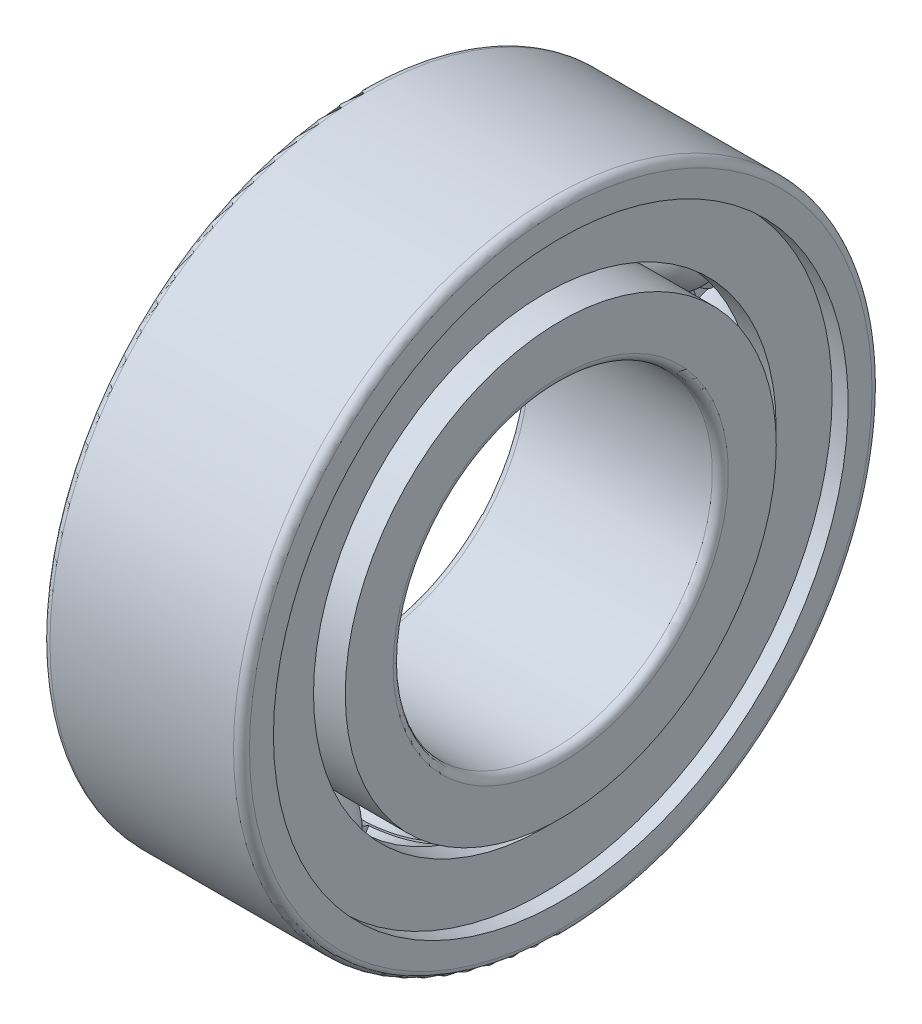
from build123d import *

# Parameters (mm, degrees)
SKETCH_2_W               = 0.528
SKETCH_2_H               = 0.66
PATTERN_CIRCULAR_1_COUNT = 13
SKETCH_4_W               = 2.64
SKETCH_4_H               = 1.32
SKETCH_5_W               = 2.64
SKETCH_5_H               = 1.32
PATTERN_CIRCULAR_2_COUNT = 13
SKETCH_10_W              = 0.535202389
SKETCH_10_H              = 1.454
SKETCH_11_R              = 8
CUT_EXTRUDE_1_DEPTH      = 10


with BuildPart() as part:
    # 草图2 → Revolve 753 (revolve)
    with BuildSketch(Plane.XY):
        with Locations((0, 6.3)):
            Rectangle(SKETCH_2_W, SKETCH_2_H)
    revolve(axis=Axis((-12.420610377, 0, 0), (1, 0, 0)))

    # 草图3 → 凸台-旋转1 (revolve)
    with BuildSketch(Plane.XY):
        with BuildLine():
            Line((-1.32, 6.3), (1.32, 6.3))
            ThreePointArc((1.32, 6.3), (0, 4.98), (-1.32, 6.3))
        make_face()
    revolve_1 = revolve(axis=Axis((-5.568093779, 6.3, 0), (1, 0, 0)))

    # 阵列(圆周)1: 凸台-旋转1 ×13 about axis
    pattern_circular_1_axis = Axis((-12.420610377, 0, 0), (1, 0, 0))
    for i in range(1, PATTERN_CIRCULAR_1_COUNT):
        add(revolve_1.rotate(pattern_circular_1_axis, i * 360 / PATTERN_CIRCULAR_1_COUNT))

    # 草图4 → 切除-旋转1 (revolve, cut)
    with BuildSketch(Plane.XY):
        with Locations((0, 7.29)):
            Rectangle(SKETCH_4_W, SKETCH_4_H)
    revolve(axis=Axis((0, 0, 0), (1, 0, 0)), mode=Mode.SUBTRACT)

    # 草图5 → 切除-旋转2 (revolve, cut)
    with BuildSketch(Plane.XY):
        with Locations((0, 5.31)):
            Rectangle(SKETCH_5_W, SKETCH_5_H)
    revolve(axis=Axis((0, 0, 0), (1, 0, 0)), mode=Mode.SUBTRACT)

    # 草图6 → 凸台-旋转2 (revolve)
    with BuildSketch(Plane.XY):
        with BuildLine():
            Line((-1.2, 6.3), (1.2, 6.3))
            ThreePointArc((1.2, 6.3), (0, 5.1), (-1.2, 6.3))
        make_face()
    revolve_2 = revolve(axis=Axis((-5.568093779, 6.3, 0), (1, 0, 0)))

    # 阵列(圆周)2: 凸台-旋转2 ×13 about axis
    pattern_circular_2_axis = Axis((-12.420610377, 0, 0), (1, 0, 0))
    for i in range(1, PATTERN_CIRCULAR_2_COUNT):
        add(revolve_2.rotate(pattern_circular_2_axis, i * 360 / PATTERN_CIRCULAR_2_COUNT))

    # 草图7 → 凸台-旋转3 (revolve)
    with BuildSketch(Plane.XY):
        with BuildLine():
            Line((-2.3, 8), (2.3, 8))
            ThreePointArc((2.3, 8), (2.441421356, 7.941421356), (2.5, 7.8))
            Line((2.5, 7.8), (2.5, 7.2))
            Line((2.5, 7.2), (2.1, 7.2))
            Line((2.1, 7.2), (2.1, 7.25))
            Line((2.1, 7.25), (1.564797611, 7.25))
            Line((1.564797611, 7.25), (1.564797611, 7.2))
            Line((1.564797611, 7.2), (0.778524245, 7.2))
            ThreePointArc((0.778524245, 7.2), (0, 7.49), (-0.778524245, 7.2))
            Line((-0.778524245, 7.2), (-2.5, 7.2))
            Line((-2.5, 7.2), (-2.5, 7.8))
            ThreePointArc((-2.5, 7.8), (-2.441421356, 7.941421356), (-2.3, 8))
        make_face()
    revolve(axis=Axis((0, 0, 0), (1, 0, 0)))

    # 草图8 → 凸台-旋转4 (revolve)
    with BuildSketch(Plane.XY):
        with BuildLine():
            Line((-2.5, 5.4), (-0.778524245, 5.4))
            ThreePointArc((-0.778524245, 5.4), (0, 5.11), (0.778524245, 5.4))
            Line((0.778524245, 5.4), (2.5, 5.4))
            Line((2.5, 5.4), (2.5, 4.2))
            ThreePointArc((2.5, 4.2), (2.441421356, 4.058578644), (2.3, 4))
            Line((2.3, 4), (-2.3, 4))
            ThreePointArc((-2.3, 4), (-2.441421356, 4.058578644), (-2.5, 4.2))
            Line((-2.5, 4.2), (-2.5, 5.4))
        make_face()
    revolve(axis=Axis((-12.420610377, 0, 0), (1, 0, 0)))

    # 草图10 → 凸台-旋转5 (revolve)
    with BuildSketch(Plane.XY):
        with Locations((1.832398806, 6.523)):
            Rectangle(SKETCH_10_W, SKETCH_10_H)
    revolve(axis=Axis((0, 0, 0), (-1, 0, 0)))

    # 草图11 → 切除-拉伸1 (cut)
    with BuildSketch(Plane(origin=(0, 0, 0), x_dir=(0, 0, -1), z_dir=(1, 0, 0))):
        Circle(SKETCH_11_R)
    extrude(amount=-CUT_EXTRUDE_1_DEPTH, mode=Mode.SUBTRACT)

    # 镜向所有1: part across plane


with BuildPart() as part_1:
    add(part.part)
    add(part.part.mirror(Plane(origin=(0, 0, 0), x_dir=(0, 0, 1), z_dir=(1, 0, 0))))


solid = part_1.part
